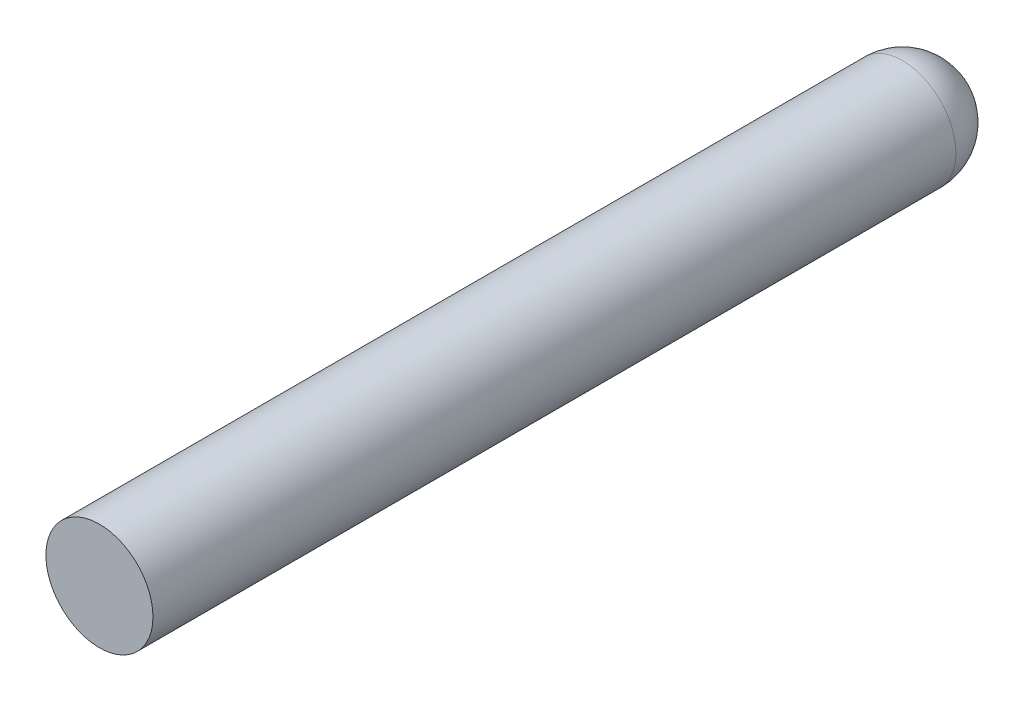
from build123d import *

# Parameters (mm, degrees)
SKETCH1_R           = 25.4
BOSS_EXTRUDE3_DEPTH = 381


with BuildPart() as part:
    # Sketch1 → Boss-Extrude3 (new body)
    with BuildSketch(Plane.XY):
        Circle(SKETCH1_R)
    extrude(amount=BOSS_EXTRUDE3_DEPTH)

    # Sketch4 → Revolve3 (revolve)
    with BuildSketch(Plane(origin=(0, 0, 0), x_dir=(1, 0, 0), z_dir=(0, 1, 0))):
        with BuildLine():
            Line((-25.4, 0), (0, 0))
            Line((0, 0), (0, 25.4))
            ThreePointArc((0, 25.4), (-17.960512242, 17.960512242), (-25.4, 0))
        make_face()
    revolve(axis=Axis((0, 0, 0), (0, 0, -1)))


solid = part.part
